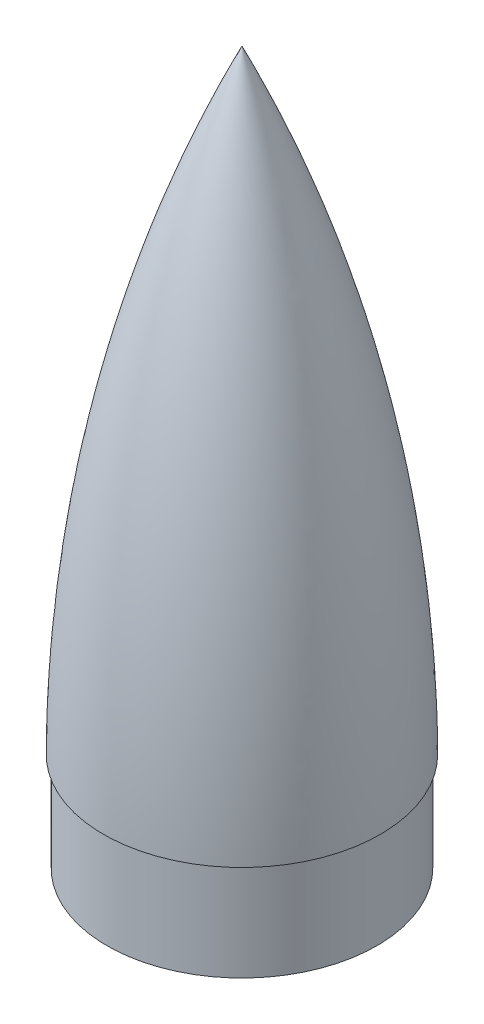
from build123d import *


with BuildPart() as part:
    # Croquis1 → Revolución1 (revolve)
    with BuildSketch(Plane(origin=(0, 0, 0), x_dir=(0, 0, -1), z_dir=(1, 0, 0))):
        with BuildLine():
            Line((52, 10), (52, 77.802029213))
            ThreePointArc((52, 77.802029213), (35.222542715, 182.66683475), (0, 282.854074446))
            Line((0, 282.854074446), (0, 290))
            ThreePointArc((0, 290), (41.804081284, 168.069080738), (56.4, 40))
            Line((56.4, 40), (55, 40))
            Line((55, 40), (55, 0))
            Line((55, 0), (52, 0))
            Line((52, 0), (0, 0))
            Line((0, 0), (0, 10))
            Line((0, 10), (52, 10))
        make_face()
    revolve(axis=Axis((0, 0, 0), (0, 1, 0)))


solid = part.part
